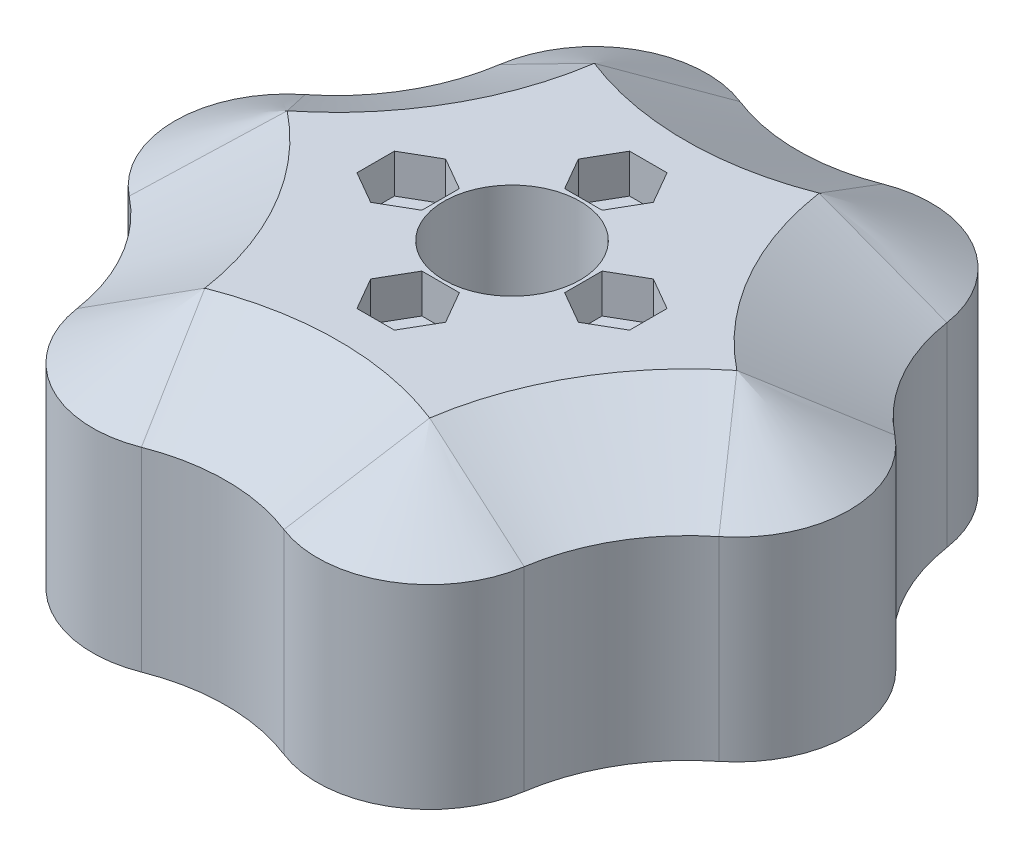
from build123d import *
from OCP.BRepFilletAPI import BRepFilletAPI_MakeChamfer

# Parameters (mm, degrees)
SKETCH1_R           = 5.25
BOSS_EXTRUDE1_DEPTH = 20
SKETCH1_3_R         = 1.5
BOSS_EXTRUDE2_DEPTH = 17
FILLET1_R           = 15
CHAMFER1_SIZE       = 8.660254038
CHAMFER1_SIZE_2     = 5


with BuildPart() as part:
    # Sketch1 → Boss-Extrude1 (new body)
    # profile 1 of 7: a face of its own
    with BuildSketch(Plane(origin=(0, 0, 0), x_dir=(1, 0, 0), z_dir=(0, 1, 0))):
        with BuildLine():
            Line((-17.320508076, 0), (-12.990381057, 7.5))
            ThreePointArc((-12.990381057, 7.5), (-25.980762114, 0), (-12.990381057, -7.5))
            Line((-12.990381057, -7.5), (-17.320508076, 0))
        make_face()
    # profile 2 of 7: a face of its own
    with BuildSketch(Plane(origin=(0, 0, 0), x_dir=(1, 0, 0), z_dir=(0, 1, 0))):
        Polygon((17.320508076, 0), (8.660254038, 15), (-8.660254038, 15), (-17.320508076, 0), (-8.660254038, -15), (8.660254038, -15), align=None)
        with Locations(Location((0, 0, 0), (0, 0, 270))):
            Circle(SKETCH1_R, mode=Mode.SUBTRACT)
        Polygon((1.443375673, -5.5), (-1.443375673, -5.5), (-2.886751346, -8), (-1.443375673, -10.5), (1.443375673, -10.5), (2.886751346, -8), align=None, mode=Mode.SUBTRACT)
        Polygon((8, 2.886751346), (5.5, 1.443375673), (5.5, -1.443375673), (8, -2.886751346), (10.5, -1.443375673), (10.5, 1.443375673), align=None, mode=Mode.SUBTRACT)
        Polygon((2.886751346, 8), (1.443375673, 10.5), (-1.443375673, 10.5), (-2.886751346, 8), (-1.443375673, 5.5), (1.443375673, 5.5), align=None, mode=Mode.SUBTRACT)
        Polygon((-8, 2.886751346), (-10.5, 1.443375673), (-10.5, -1.443375673), (-8, -2.886751346), (-5.5, -1.443375673), (-5.5, 1.443375673), align=None, mode=Mode.SUBTRACT)
    # profile 3 of 7: a face of its own
    with BuildSketch(Plane(origin=(0, 0, 0), x_dir=(1, 0, 0), z_dir=(0, 1, 0))):
        with BuildLine():
            Line((-12.990381057, 7.5), (-8.660254038, 15))
            Line((-8.660254038, 15), (0, 15))
            ThreePointArc((0, 15), (-12.990381057, 22.5), (-12.990381057, 7.5))
        make_face()
    # profile 4 of 7: a face of its own
    with BuildSketch(Plane(origin=(0, 0, 0), x_dir=(1, 0, 0), z_dir=(0, 1, 0))):
        with BuildLine():
            ThreePointArc((12.990381057, 7.5), (12.990381057, 22.5), (0, 15))
            Line((0, 15), (8.660254038, 15))
            Line((8.660254038, 15), (12.990381057, 7.5))
        make_face()
    # profile 5 of 7: a face of its own
    with BuildSketch(Plane(origin=(0, 0, 0), x_dir=(1, 0, 0), z_dir=(0, 1, 0))):
        with BuildLine():
            ThreePointArc((12.990381057, -7.5), (25.980762114, 0), (12.990381057, 7.5))
            Line((12.990381057, 7.5), (17.320508076, 0))
            Line((17.320508076, 0), (12.990381057, -7.5))
        make_face()
    # profile 6 of 7: a face of its own
    with BuildSketch(Plane(origin=(0, 0, 0), x_dir=(1, 0, 0), z_dir=(0, 1, 0))):
        with BuildLine():
            Line((8.660254038, -15), (0, -15))
            ThreePointArc((0, -15), (12.990381057, -22.5), (12.990381057, -7.5))
            Line((12.990381057, -7.5), (8.660254038, -15))
        make_face()
    # profile 7 of 7: a face of its own
    with BuildSketch(Plane(origin=(0, 0, 0), x_dir=(1, 0, 0), z_dir=(0, 1, 0))):
        with BuildLine():
            Line((-8.660254038, -15), (-12.990381057, -7.5))
            ThreePointArc((-12.990381057, -7.5), (-12.990381057, -22.5), (0, -15))
            Line((0, -15), (-8.660254038, -15))
        make_face()
    extrude(amount=BOSS_EXTRUDE1_DEPTH)

    # Sketch1<3> → Boss-Extrude2 (add)
    # profile 1 of 4: a face of its own
    with BuildSketch(Plane(origin=(0, 0, 0), x_dir=(1, 0, 0), z_dir=(0, 1, 0))):
        Polygon((-8.977463126, 2.322412747), (-10.5, 1.443375673), (-10.5, -1.443375673), (-8.977463126, -2.322412747), (-8, -2.886751346), (-5.5, -1.443375673), (-5.5, 1.443375673), (-8, 2.886751346), align=None)
        with Locations(Location((-8, 0, 0), (0, 0, 90))):
            Circle(SKETCH1_3_R, mode=Mode.SUBTRACT)
    # profile 2 of 4: a face of its own
    with BuildSketch(Plane(origin=(0, 0, 0), x_dir=(1, 0, 0), z_dir=(0, 1, 0))):
        Polygon((2.128194303, 9.313859338), (1.443375673, 10.5), (-1.443375673, 10.5), (-2.128194303, 9.313859338), (-2.886751346, 8), (-1.443375673, 5.5), (1.443375673, 5.5), (2.886751346, 8), align=None)
        with Locations(Location((0, 8, 0), (0, 0, 90))):
            Circle(SKETCH1_3_R, mode=Mode.SUBTRACT)
    # profile 3 of 4: a face of its own
    with BuildSketch(Plane(origin=(0, 0, 0), x_dir=(1, 0, 0), z_dir=(0, 1, 0))):
        Polygon((8, 2.886751346), (5.5, 1.443375673), (5.5, -1.443375673), (8, -2.886751346), (8.977463126, -2.322412747), (10.5, -1.443375673), (10.5, 1.443375673), (8.977463126, 2.322412747), align=None)
        with Locations(Location((8, 0, 0), (0, 0, 90))):
            Circle(SKETCH1_3_R, mode=Mode.SUBTRACT)
    # profile 4 of 4: a face of its own
    with BuildSketch(Plane(origin=(0, 0, 0), x_dir=(1, 0, 0), z_dir=(0, 1, 0))):
        Polygon((1.443375673, -5.5), (-1.443375673, -5.5), (-2.886751346, -8), (-2.128194303, -9.313859338), (-1.443375673, -10.5), (1.443375673, -10.5), (2.128194303, -9.313859338), (2.886751346, -8), align=None)
        with Locations(Location((0, -8, 0), (0, 0, 90))):
            Circle(SKETCH1_3_R, mode=Mode.SUBTRACT)
    extrude(amount=BOSS_EXTRUDE2_DEPTH)

    # Fillet1
    fillet1_edges = [part.edges().sort_by_distance(p)[0] for p in [
        (12.990381057, 10, 7.5),
        (0, 10, 15),
        (-12.990381057, 10, 7.5),
        (-12.990381057, 10, -7.5),
        (0, 10, -15),
        (12.990381057, 10, -7.5),
    ]]
    fillet(fillet1_edges, radius=FILLET1_R)

    # Chamfer1
    chamfer1_edges_1 = [part.edges().sort_by_distance(p)[0] for p in [
        (12.990381057, 20, 22.5),
    ]]
    chamfer1_side_1 = [part.faces().sort_by_distance(p)[0] for p in [
        (12.940381057, 20, 22.41339746),
    ]]
    chamfer1_edges_2 = [part.edges().sort_by_distance(p)[0] for p in [
        (-12.990381057, 20, 22.5),
    ]]
    chamfer1_side_2 = [part.faces().sort_by_distance(p)[0] for p in [
        (-12.940381057, 20, 22.41339746),
    ]]
    chamfer1_edges_3 = [part.edges().sort_by_distance(p)[0] for p in [
        (25.980762114, 20, 0),
    ]]
    chamfer1_side_3 = [part.faces().sort_by_distance(p)[0] for p in [
        (25.880762114, 20, 0),
    ]]
    chamfer1_edges_4 = [part.edges().sort_by_distance(p)[0] for p in [
        (12.990381057, 20, -22.5),
    ]]
    chamfer1_side_4 = [part.faces().sort_by_distance(p)[0] for p in [
        (12.940381057, 20, -22.41339746),
    ]]
    chamfer1_edges_5 = [part.edges().sort_by_distance(p)[0] for p in [
        (-12.990381057, 20, -22.5),
    ]]
    chamfer1_side_5 = [part.faces().sort_by_distance(p)[0] for p in [
        (-12.940381057, 20, -22.41339746),
    ]]
    chamfer1_edges_6 = [part.edges().sort_by_distance(p)[0] for p in [
        (-25.980762114, 20, 0),
    ]]
    chamfer1_side_6 = [part.faces().sort_by_distance(p)[0] for p in [
        (-25.980762114, 19.9, 0),
    ]]
    chamfer1_edges_7 = [part.edges().sort_by_distance(p)[0] for p in [
        (0, 20, 22.018347375),
    ]]
    chamfer1_side_7 = [part.faces().sort_by_distance(p)[0] for p in [
        (0, 20, 21.918347375),
    ]]
    chamfer1_edges_8 = [part.edges().sort_by_distance(p)[0] for p in [
        (19.068448176, 20, 11.009173688),
    ]]
    chamfer1_side_8 = [part.faces().sort_by_distance(p)[0] for p in [
        (18.981845636, 20, 10.959173688),
    ]]
    chamfer1_edges_9 = [part.edges().sort_by_distance(p)[0] for p in [
        (19.068448176, 20, -11.009173688),
    ]]
    chamfer1_side_9 = [part.faces().sort_by_distance(p)[0] for p in [
        (18.981845636, 20, -10.959173688),
    ]]
    chamfer1_edges_10 = [part.edges().sort_by_distance(p)[0] for p in [
        (0, 20, -22.018347375),
    ]]
    chamfer1_side_10 = [part.faces().sort_by_distance(p)[0] for p in [
        (0, 20, -21.918347375),
    ]]
    chamfer1_edges_11 = [part.edges().sort_by_distance(p)[0] for p in [
        (-19.068448176, 20, -11.009173688),
    ]]
    chamfer1_side_11 = [part.faces().sort_by_distance(p)[0] for p in [
        (-19.068448176, 19.9, -11.009173688),
    ]]
    chamfer1_edges_12 = [part.edges().sort_by_distance(p)[0] for p in [
        (-19.068448176, 20, 11.009173688),
    ]]
    chamfer1_side_12 = [part.faces().sort_by_distance(p)[0] for p in [
        (-19.068448176, 19.9, 11.009173688),
    ]]
    chamfer1 = BRepFilletAPI_MakeChamfer(part.part.solid().wrapped)
    for e in chamfer1_edges_1:
        chamfer1.Add(CHAMFER1_SIZE - 0.0001, CHAMFER1_SIZE_2 - 0.0001, e.wrapped, chamfer1_side_1[0].wrapped)
    for e in chamfer1_edges_2:
        chamfer1.Add(CHAMFER1_SIZE - 0.0001, CHAMFER1_SIZE_2 - 0.0001, e.wrapped, chamfer1_side_2[0].wrapped)
    for e in chamfer1_edges_3:
        chamfer1.Add(CHAMFER1_SIZE - 0.0001, CHAMFER1_SIZE_2 - 0.0001, e.wrapped, chamfer1_side_3[0].wrapped)
    for e in chamfer1_edges_4:
        chamfer1.Add(CHAMFER1_SIZE - 0.0001, CHAMFER1_SIZE_2 - 0.0001, e.wrapped, chamfer1_side_4[0].wrapped)
    for e in chamfer1_edges_5:
        chamfer1.Add(CHAMFER1_SIZE - 0.0001, CHAMFER1_SIZE_2 - 0.0001, e.wrapped, chamfer1_side_5[0].wrapped)
    for e in chamfer1_edges_6:
        chamfer1.Add(CHAMFER1_SIZE_2 - 0.0001, CHAMFER1_SIZE - 0.0001, e.wrapped, chamfer1_side_6[0].wrapped)
    for e in chamfer1_edges_7:
        chamfer1.Add(CHAMFER1_SIZE - 0.0001, CHAMFER1_SIZE_2 - 0.0001, e.wrapped, chamfer1_side_7[0].wrapped)
    for e in chamfer1_edges_8:
        chamfer1.Add(CHAMFER1_SIZE - 0.0001, CHAMFER1_SIZE_2 - 0.0001, e.wrapped, chamfer1_side_8[0].wrapped)
    for e in chamfer1_edges_9:
        chamfer1.Add(CHAMFER1_SIZE - 0.0001, CHAMFER1_SIZE_2 - 0.0001, e.wrapped, chamfer1_side_9[0].wrapped)
    for e in chamfer1_edges_10:
        chamfer1.Add(CHAMFER1_SIZE - 0.0001, CHAMFER1_SIZE_2 - 0.0001, e.wrapped, chamfer1_side_10[0].wrapped)
    for e in chamfer1_edges_11:
        chamfer1.Add(CHAMFER1_SIZE_2 - 0.0001, CHAMFER1_SIZE - 0.0001, e.wrapped, chamfer1_side_11[0].wrapped)
    for e in chamfer1_edges_12:
        chamfer1.Add(CHAMFER1_SIZE_2 - 0.0001, CHAMFER1_SIZE - 0.0001, e.wrapped, chamfer1_side_12[0].wrapped)
    add(Compound.cast(chamfer1.Shape()), mode=Mode.REPLACE)  # a hair under: the kernel refuses the full size


solid = part.part
